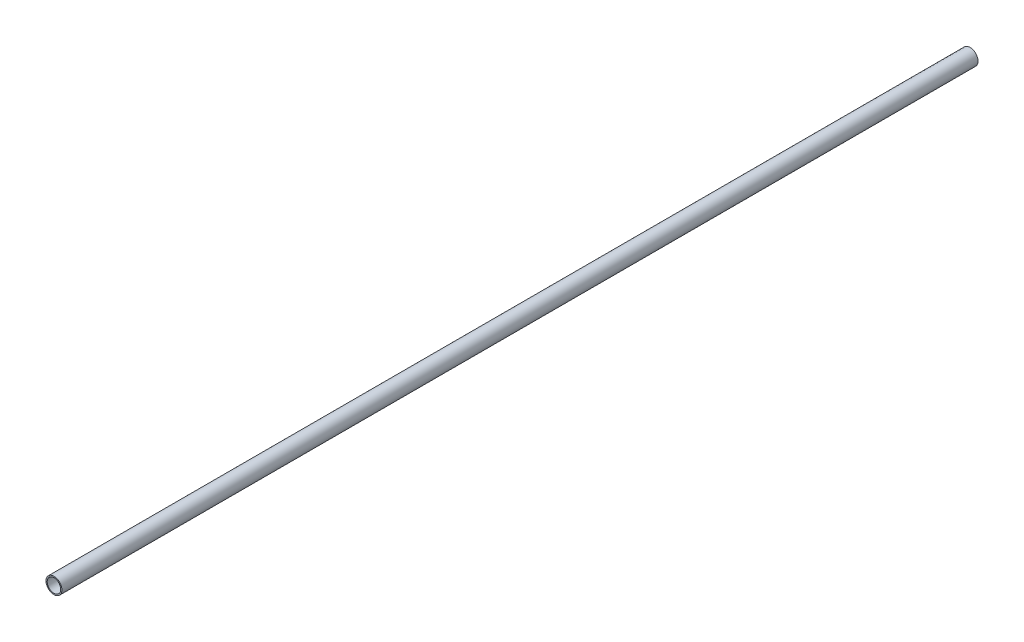
from build123d import *

# Parameters (mm, degrees)
SKETCH1_R           = 15.875
SKETCH1_R_2         = 13.462
BOSS_EXTRUDE1_DEPTH = 1828.8


with BuildPart() as part:
    # Sketch1 → Boss-Extrude1 (new body)
    with BuildSketch(Plane.XY):
        Circle(SKETCH1_R)
        Circle(SKETCH1_R_2, mode=Mode.SUBTRACT)
    extrude(amount=BOSS_EXTRUDE1_DEPTH)


solid = part.part
